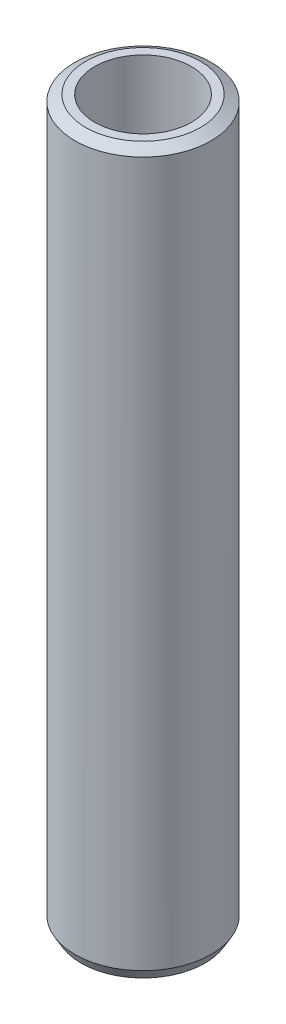
from build123d import *
from OCP.BRepFilletAPI import BRepFilletAPI_MakeChamfer

# Parameters (mm, degrees)
SKETCH1_R           = 22.5
BOSS_EXTRUDE1_DEPTH = 238.473349988
SKETCH2_R           = 15.991985144
CUT_EXTRUDE1_DEPTH  = 241.586863013
CHAMFER1_SIZE       = 2.03610058
CHAMFER1_SIZE2      = 3.526629655


with BuildPart() as part:
    # Sketch1 → Boss-Extrude1 (new body)
    with BuildSketch(Plane(origin=(0, 0, 0), x_dir=(1, 0, 0), z_dir=(0, 1, 0))):
        Circle(SKETCH1_R)
    extrude(amount=BOSS_EXTRUDE1_DEPTH)

    # Sketch2 → Cut-Extrude1 (cut, through all)
    with BuildSketch(Plane(origin=(0, 0, 0), x_dir=(1, 0, 0), z_dir=(0, 1, 0))):
        Circle(SKETCH2_R)
    extrude(amount=CUT_EXTRUDE1_DEPTH, mode=Mode.SUBTRACT)

    # Chamfer1: one chamfer whose edges measure the first distance from different faces: ONE call of the kernel's chamfer builder (chamfer() names one face for all edges)
    chamfer1_edges_1 = [part.edges().sort_by_distance(p)[0] for p in [
        (-22.5, 238.473349988, 0),
    ]]
    chamfer1_side_1 = [part.faces().sort_by_distance(p)[0] for p in [
        (-22.5, 119.236674994, 0),
    ]]
    chamfer1_edges_2 = [part.edges().sort_by_distance(p)[0] for p in [
        (-22.5, 0, 0),
    ]]
    chamfer1_side_2 = [part.faces().sort_by_distance(p)[0] for p in [
        (-21.863603897, 0, 0),
    ]]
    chamfer1 = BRepFilletAPI_MakeChamfer(part.part.solid().wrapped)
    for e in chamfer1_edges_1:
        chamfer1.Add(CHAMFER1_SIZE, CHAMFER1_SIZE2, e.wrapped, chamfer1_side_1[0].wrapped)  # the first distance lies on this face
    for e in chamfer1_edges_2:
        chamfer1.Add(CHAMFER1_SIZE, CHAMFER1_SIZE2, e.wrapped, chamfer1_side_2[0].wrapped)  # the first distance lies on this face
    add(Compound.cast(chamfer1.Shape()), mode=Mode.REPLACE)


solid = part.part
